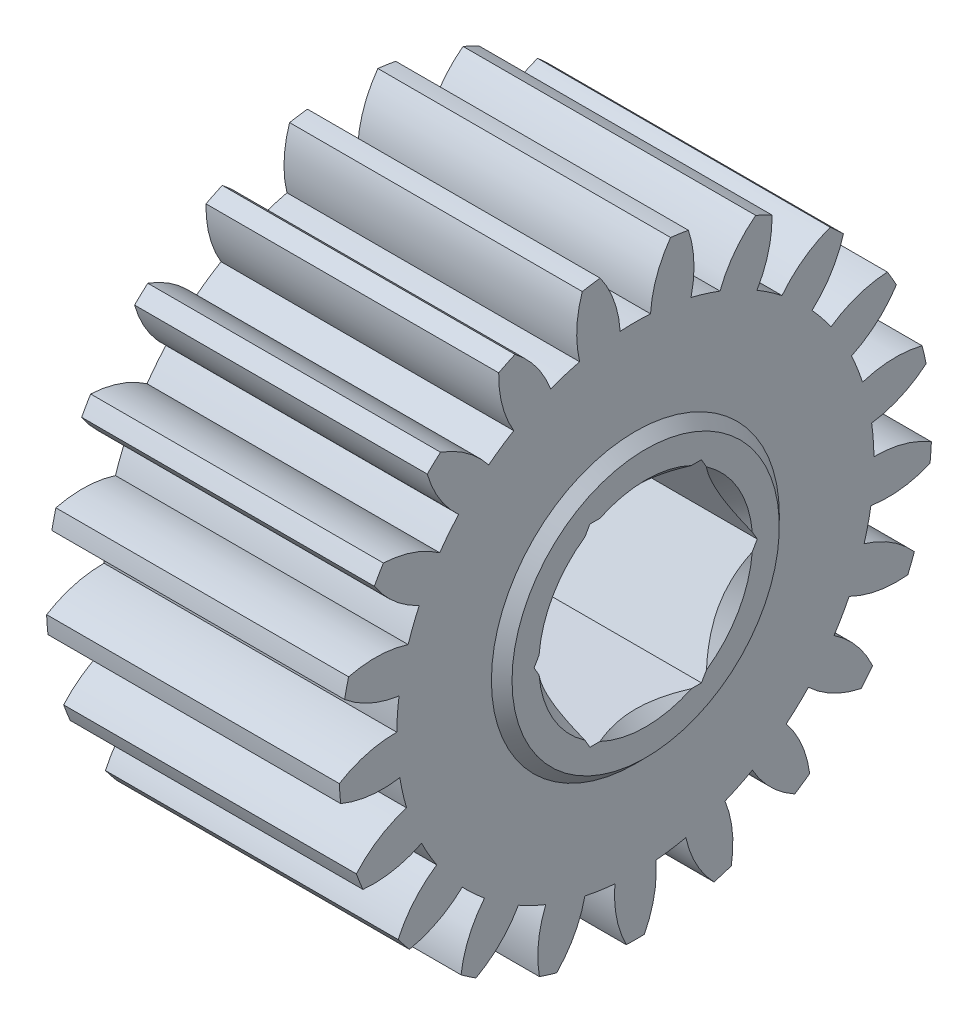
from build123d import *

# Parameters (mm, degrees)
BOSS_EXTRUDE1_OUTLINE_R = 14.605
BOSS_EXTRUDE1_DEPTH     = 14.42720006
BOSS_EXTRUDE1_START     = 14.4272
BOSS_EXTRUDE1_3_DEPTH   = 1.5728
CUT_EXTRUDE1_DEPTH      = 26.488669032
CUT_EXTRUDE2_DEPTH      = 26.488669032
CUT_EXTRUDE3_DEPTH      = 26.488669032
CUT_EXTRUDE4_DEPTH      = 26.488669032
CUT_EXTRUDE5_DEPTH      = 26.488669032
CUT_EXTRUDE6_DEPTH      = 26.488669032
CUT_EXTRUDE7_DEPTH      = 26.488669032
CUT_EXTRUDE8_DEPTH      = 26.488669032
CUT_EXTRUDE9_DEPTH      = 26.488669032
CUT_EXTRUDE10_DEPTH     = 26.488669032
CUT_EXTRUDE11_DEPTH     = 26.488669032
CUT_EXTRUDE12_DEPTH     = 26.488669032
CUT_EXTRUDE13_DEPTH     = 26.488669032
CUT_EXTRUDE14_DEPTH     = 26.488669032
CUT_EXTRUDE15_DEPTH     = 26.488669032
CUT_EXTRUDE16_DEPTH     = 26.488669032
CUT_EXTRUDE17_DEPTH     = 26.488669032
CUT_EXTRUDE18_DEPTH     = 26.488669032
CUT_EXTRUDE19_DEPTH     = 26.480457984
CUT_EXTRUDE20_DEPTH     = 26.480457984
CUT_EXTRUDE21_DEPTH     = 26.480457984


with BuildPart() as part:
    # Boss-Extrude1: read off the stored shape, not the designer's step
    # Boss-Extrude1 outline → Boss-Extrude1 (new body)
    with BuildSketch(Plane.ZY.offset(-14.4272)):
        Circle(BOSS_EXTRUDE1_OUTLINE_R)
        Polygon((-2.749630657, 4.7625), (2.749630657, 4.7625), (5.499261314, 0), (2.749630657, -4.7625), (-2.749630657, -4.7625), (-5.499261314, 0), align=None, mode=Mode.SUBTRACT)
    extrude(amount=BOSS_EXTRUDE1_DEPTH)

    # Boss-Extrude1 2 outline → Boss-Extrude1 2 (revolve)
    with BuildSketch(Plane.YX):
        Polygon((7.095071798, 14.4272), (6.587071798, 14.9352), (5.2705, 14.9352), (4.7625, 14.4272), align=None)
    revolve(axis=Axis((0, 0, 0), (1, 0, 0)))

    # Boss-Extrude1 3 outline → Boss-Extrude1 3 (cut)
    with BuildSketch(Plane.YZ.offset(BOSS_EXTRUDE1_START)):
        Polygon((0, -5.499261314), (4.7625, -2.749630657), (4.7625, 2.749630657), (0, 5.499261314), (-4.7625, 2.749630657), (-4.7625, -2.749630657), align=None)
    extrude(amount=BOSS_EXTRUDE1_3_DEPTH, mode=Mode.SUBTRACT)

    # Sketch2 → Cut-Extrude1 (cut, through all)
    with BuildSketch(Plane.ZY):
        with BuildLine():
            ThreePointArc((-2.616024723, 14.368800912), (-4.304899322, 13.956140829), (-5.932772703, 13.345719653))
            ThreePointArc((-5.932772703, 13.345719653), (-4.888353183, 12.293571261), (-4.173865194, 10.994596554))
            ThreePointArc((-4.173865194, 10.994596554), (-3.466379802, 11.237727311), (-2.744867507, 11.435383964))
            ThreePointArc((-2.744867507, 11.435383964), (-2.886268334, 12.911132649), (-2.616024723, 14.368800912))
        make_face()
    extrude(amount=-CUT_EXTRUDE1_DEPTH, mode=Mode.SUBTRACT)

    # Sketch3 → Cut-Extrude2 (cut, through all)
    with BuildSketch(Plane.ZY):
        with BuildLine():
            ThreePointArc((1.735476334, 14.501522227), (0, 14.605), (-1.735476334, 14.501522227))
            ThreePointArc((-1.735476334, 14.501522227), (-1.047583625, 13.188269777), (-0.74771785, 11.736405841))
            ThreePointArc((-0.74771785, 11.736405841), (0, 11.7602), (0.74771785, 11.736405841))
            ThreePointArc((0.74771785, 11.736405841), (1.047583625, 13.188269777), (1.735476334, 14.501522227))
        make_face()
    extrude(amount=-CUT_EXTRUDE2_DEPTH, mode=Mode.SUBTRACT)

    # Sketch4 → Cut-Extrude3 (cut, through all)
    with BuildSketch(Plane.ZY):
        with BuildLine():
            ThreePointArc((5.932772703, 13.345719653), (4.304899322, 13.956140829), (2.616024723, 14.368800912))
            ThreePointArc((2.616024723, 14.368800912), (2.886268334, 12.911132649), (2.744867507, 11.435383964))
            ThreePointArc((2.744867507, 11.435383964), (3.466379802, 11.237727311), (4.173865194, 10.994596554))
            ThreePointArc((4.173865194, 10.994596554), (4.888353183, 12.293571261), (5.932772703, 13.345719653))
        make_face()
    extrude(amount=-CUT_EXTRUDE3_DEPTH, mode=Mode.SUBTRACT)

    # Sketch5 → Cut-Extrude4 (cut, through all)
    with BuildSketch(Plane.ZY):
        with BuildLine():
            ThreePointArc((9.602916182, 11.004091321), (8.227289448, 12.067217299), (6.735080503, 12.95934858))
            ThreePointArc((6.735080503, 12.95934858), (6.563662686, 11.486784725), (5.99355934, 10.118278039))
            ThreePointArc((5.99355934, 10.118278039), (6.624756547, 9.716733234), (7.229146299, 9.275869114))
            ThreePointArc((7.229146299, 9.275869114), (8.294771107, 10.306534988), (9.602916182, 11.004091321))
        make_face()
    extrude(amount=-CUT_EXTRUDE4_DEPTH, mode=Mode.SUBTRACT)

    # Sketch6 → Cut-Extrude5 (cut, through all)
    with BuildSketch(Plane.ZY):
        with BuildLine():
            ThreePointArc((12.419798416, 7.684701184), (11.418648801, 9.106068556), (10.255694825, 10.398401255))
            ThreePointArc((10.255694825, 10.398401255), (9.657846804, 9.041785569), (8.709697123, 7.902118707))
            ThreePointArc((8.709697123, 7.902118707), (9.1944946, 7.332364768), (9.642086031, 6.732939997))
            ThreePointArc((9.642086031, 6.732939997), (10.964162218, 7.403717852), (12.419798416, 7.684701184))
        make_face()
    extrude(amount=-CUT_EXTRUDE5_DEPTH, mode=Mode.SUBTRACT)

    # Sketch7 → Cut-Extrude6 (cut, through all)
    with BuildSketch(Plane.ZY):
        with BuildLine():
            ThreePointArc((14.133127058, 3.682491624), (13.595411099, 5.335805661), (12.865045654, 6.913510346))
            ThreePointArc((12.865045654, 6.913510346), (11.893888851, 5.793384087), (10.651940095, 4.98382145))
            ThreePointArc((10.651940095, 4.98382145), (10.947261459, 4.296483515), (11.198284106, 3.591759615))
            ThreePointArc((11.198284106, 3.591759615), (12.659339401, 3.843047894), (14.133127058, 3.682491624))
        make_face()
    extrude(amount=-CUT_EXTRUDE6_DEPTH, mode=Mode.SUBTRACT)

    # Sketch8 → Cut-Extrude7 (cut, through all)
    with BuildSketch(Plane.ZY):
        with BuildLine():
            ThreePointArc((14.590665338, -0.646923477), (14.564161458, 1.091433017), (14.331280721, 2.814323704))
            ThreePointArc((14.331280721, 2.814323704), (13.073106678, 2.030215004), (11.647711445, 1.622689786))
            ThreePointArc((11.647711445, 1.622689786), (11.727316096, 0.878840847), (11.759465494, 0.131435628))
            ThreePointArc((11.759465494, 0.131435628), (13.229678723, -0.059093734), (14.590665338, -0.646923477))
        make_face()
    extrude(amount=-CUT_EXTRUDE7_DEPTH, mode=Mode.SUBTRACT)

    # Sketch9 → Cut-Extrude8 (cut, through all)
    with BuildSketch(Plane.ZY):
        with BuildLine():
            ThreePointArc((13.751758973, -4.918856589), (14.238822157, -3.24991824), (14.524118603, -1.53492795))
            ThreePointArc((14.524118603, -1.53492795), (13.090721606, -1.913347591), (11.608532517, -1.882624987))
            ThreePointArc((11.608532517, -1.882624987), (11.465347233, -2.616890688), (11.275766769, -3.340566991))
            ThreePointArc((11.275766769, -3.340566991), (12.624503033, -3.955984625), (13.751758973, -4.918856589))
        make_face()
    extrude(amount=-CUT_EXTRUDE8_DEPTH, mode=Mode.SUBTRACT)

    # Sketch10 → Cut-Extrude9 (cut, through all)
    with BuildSketch(Plane.ZY):
        with BuildLine():
            ThreePointArc((11.690948475, -8.753727707), (12.648301022, -7.3025), (13.426424809, -5.74779452))
            ThreePointArc((13.426424809, -5.74779452), (11.945168472, -5.686900857), (10.537884532, -5.220660268))
            ThreePointArc((10.537884532, -5.220660268), (10.184631954, -5.8801), (9.790166682, -6.515745573))
            ThreePointArc((9.790166682, -6.515745573), (10.897584847, -7.501368921), (11.690948475, -8.753727707))
        make_face()
    extrude(amount=-CUT_EXTRUDE9_DEPTH, mode=Mode.SUBTRACT)

    # Sketch11 → Cut-Extrude10 (cut, through all)
    with BuildSketch(Plane.ZY):
        with BuildLine():
            ThreePointArc((8.591345899, -11.810791702), (9.933922835, -10.706222588), (11.13573425, -9.449944323))
            ThreePointArc((11.13573425, -9.449944323), (9.738234699, -8.955148024), (8.530899261, -8.094816973))
            ThreePointArc((8.530899261, -8.094816973), (7.998967431, -8.620836623), (7.434667323, -9.111971567))
            ThreePointArc((7.434667323, -9.111971567), (8.202368424, -10.380223669), (8.591345899, -11.810791702))
        make_face()
    extrude(amount=-CUT_EXTRUDE10_DEPTH, mode=Mode.SUBTRACT)

    # Sketch12 → Cut-Extrude11 (cut, through all)
    with BuildSketch(Plane.ZY):
        with BuildLine():
            ThreePointArc((4.728364538, -13.818415025), (6.33687201, -13.158650316), (7.855584835, -12.312425102))
            ThreePointArc((7.855584835, -12.312425102), (6.666016037, -11.427690991), (5.765906154, -10.249713667))
            ThreePointArc((5.765906154, -10.249713667), (5.102559549, -10.59557408), (4.418565146, -10.8985589))
            ThreePointArc((4.418565146, -10.8985589), (4.778335571, -12.336749991), (4.728364538, -13.818415025))
        make_face()
    extrude(amount=-CUT_EXTRUDE11_DEPTH, mode=Mode.SUBTRACT)

    # Sketch13 → Cut-Extrude12 (cut, through all)
    with BuildSketch(Plane.ZY):
        with BuildLine():
            ThreePointArc((0.445247238, -14.598211531), (2.176762298, -14.441874217), (3.877432233, -14.080892879))
            ThreePointArc((3.877432233, -14.080892879), (3.001492596, -12.884833463), (2.488586982, -11.493878322))
            ThreePointArc((2.488586982, -11.493878322), (1.752766859, -11.628848283), (1.009854064, -11.716761447))
            ThreePointArc((1.009854064, -11.716761447), (0.929726633, -13.197101938), (0.445247238, -14.598211531))
        make_face()
    extrude(amount=-CUT_EXTRUDE12_DEPTH, mode=Mode.SUBTRACT)

    # Sketch14 → Cut-Extrude13 (cut, through all)
    with BuildSketch(Plane.ZY):
        with BuildLine():
            ThreePointArc((-3.877432233, -14.080892879), (-2.176762298, -14.441874217), (-0.445247238, -14.598211531))
            ThreePointArc((-0.445247238, -14.598211531), (-0.929726633, -13.197101938), (-1.009854064, -11.716761447))
            ThreePointArc((-1.009854064, -11.716761447), (-1.752766859, -11.628848283), (-2.488586982, -11.493878322))
            ThreePointArc((-2.488586982, -11.493878322), (-3.001492596, -12.884833463), (-3.877432233, -14.080892879))
        make_face()
    extrude(amount=-CUT_EXTRUDE13_DEPTH, mode=Mode.SUBTRACT)

    # Sketch15 → Cut-Extrude14 (cut, through all)
    with BuildSketch(Plane.ZY):
        with BuildLine():
            ThreePointArc((-7.855584835, -12.312425102), (-6.33687201, -13.158650316), (-4.728364538, -13.818415025))
            ThreePointArc((-4.728364538, -13.818415025), (-4.778335571, -12.336749991), (-4.418565146, -10.8985589))
            ThreePointArc((-4.418565146, -10.8985589), (-5.102559549, -10.59557408), (-5.765906154, -10.249713667))
            ThreePointArc((-5.765906154, -10.249713667), (-6.666016037, -11.427690991), (-7.855584835, -12.312425102))
        make_face()
    extrude(amount=-CUT_EXTRUDE14_DEPTH, mode=Mode.SUBTRACT)

    # Sketch16 → Cut-Extrude15 (cut, through all)
    with BuildSketch(Plane.ZY):
        with BuildLine():
            ThreePointArc((-11.13573425, -9.449944323), (-9.933922835, -10.706222588), (-8.591345899, -11.810791702))
            ThreePointArc((-8.591345899, -11.810791702), (-8.202368424, -10.380223669), (-7.434667323, -9.111971567))
            ThreePointArc((-7.434667323, -9.111971567), (-7.998967431, -8.620836623), (-8.530899261, -8.094816973))
            ThreePointArc((-8.530899261, -8.094816973), (-9.738234699, -8.955148024), (-11.13573425, -9.449944323))
        make_face()
    extrude(amount=-CUT_EXTRUDE15_DEPTH, mode=Mode.SUBTRACT)

    # Sketch17 → Cut-Extrude16 (cut, through all)
    with BuildSketch(Plane.ZY):
        with BuildLine():
            ThreePointArc((-13.426424809, -5.74779452), (-12.648301022, -7.3025), (-11.690948475, -8.753727707))
            ThreePointArc((-11.690948475, -8.753727707), (-10.897584847, -7.501368921), (-9.790166682, -6.515745573))
            ThreePointArc((-9.790166682, -6.515745573), (-10.184631954, -5.8801), (-10.537884532, -5.220660268))
            ThreePointArc((-10.537884532, -5.220660268), (-11.945168472, -5.686900857), (-13.426424809, -5.74779452))
        make_face()
    extrude(amount=-CUT_EXTRUDE16_DEPTH, mode=Mode.SUBTRACT)

    # Sketch18 → Cut-Extrude17 (cut, through all)
    with BuildSketch(Plane.ZY):
        with BuildLine():
            ThreePointArc((-14.524118603, -1.53492795), (-14.238822157, -3.24991824), (-13.751758973, -4.918856589))
            ThreePointArc((-13.751758973, -4.918856589), (-12.624503033, -3.955984625), (-11.275766769, -3.340566991))
            ThreePointArc((-11.275766769, -3.340566991), (-11.465347233, -2.616890688), (-11.608532517, -1.882624987))
            ThreePointArc((-11.608532517, -1.882624987), (-13.090721606, -1.913347591), (-14.524118603, -1.53492795))
        make_face()
    extrude(amount=-CUT_EXTRUDE17_DEPTH, mode=Mode.SUBTRACT)

    # Sketch19 → Cut-Extrude18 (cut, through all)
    with BuildSketch(Plane.ZY):
        with BuildLine():
            ThreePointArc((-14.331280721, 2.814323704), (-14.564161458, 1.091433017), (-14.590665338, -0.646923477))
            ThreePointArc((-14.590665338, -0.646923477), (-13.229678723, -0.059093734), (-11.759465494, 0.131435628))
            ThreePointArc((-11.759465494, 0.131435628), (-11.727316096, 0.878840847), (-11.647711445, 1.622689786))
            ThreePointArc((-11.647711445, 1.622689786), (-13.073106678, 2.030215004), (-14.331280721, 2.814323704))
        make_face()
    extrude(amount=-CUT_EXTRUDE18_DEPTH, mode=Mode.SUBTRACT)

    # Sketch20 → Cut-Extrude19 (cut, through all)
    with BuildSketch(Plane.ZY):
        with BuildLine():
            ThreePointArc((-12.865045654, 6.913510346), (-13.595411099, 5.335805661), (-14.133127058, 3.682491624))
            ThreePointArc((-14.133127058, 3.682491624), (-12.659339401, 3.843047894), (-11.198284106, 3.591759615))
            ThreePointArc((-11.198284106, 3.591759615), (-10.947261459, 4.296483515), (-10.651940095, 4.98382145))
            ThreePointArc((-10.651940095, 4.98382145), (-11.893888851, 5.793384087), (-12.865045654, 6.913510346))
        make_face()
    extrude(amount=-CUT_EXTRUDE19_DEPTH, mode=Mode.SUBTRACT)

    # Sketch21 → Cut-Extrude20 (cut, through all)
    with BuildSketch(Plane.ZY):
        with BuildLine():
            ThreePointArc((-10.255694825, 10.398401255), (-11.418648801, 9.106068556), (-12.419798416, 7.684701184))
            ThreePointArc((-12.419798416, 7.684701184), (-10.964162218, 7.403717852), (-9.642086031, 6.732939997))
            ThreePointArc((-9.642086031, 6.732939997), (-9.1944946, 7.332364768), (-8.709697123, 7.902118707))
            ThreePointArc((-8.709697123, 7.902118707), (-9.657846804, 9.041785569), (-10.255694825, 10.398401255))
        make_face()
    extrude(amount=-CUT_EXTRUDE20_DEPTH, mode=Mode.SUBTRACT)

    # Sketch22 → Cut-Extrude21 (cut, through all)
    with BuildSketch(Plane.ZY):
        with BuildLine():
            ThreePointArc((-6.735080503, 12.95934858), (-8.227289448, 12.067217299), (-9.602916182, 11.004091321))
            ThreePointArc((-9.602916182, 11.004091321), (-8.294771107, 10.306534988), (-7.229146299, 9.275869114))
            ThreePointArc((-7.229146299, 9.275869114), (-6.624756547, 9.716733234), (-5.99355934, 10.118278039))
            ThreePointArc((-5.99355934, 10.118278039), (-6.563662686, 11.486784725), (-6.735080503, 12.95934858))
        make_face()
    extrude(amount=-CUT_EXTRUDE21_DEPTH, mode=Mode.SUBTRACT)


solid = part.part
